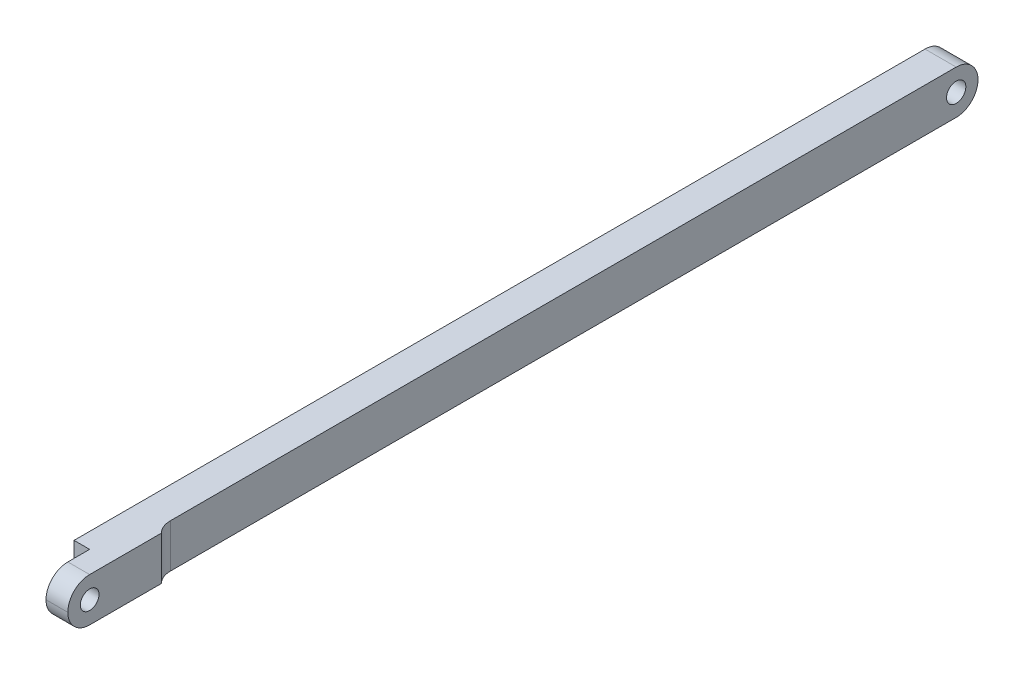
from build123d import *

# Parameters (mm, degrees)
SKETCH_1_W          = 5
SKETCH_1_H          = 7
EXTRUDE_2_DEPTH     = 140
FILLET_1_R          = 3.5
SKETCH_3_R          = 1.55
CUT_EXTRUDE_1_DEPTH = 141.132972565
SKETCH_4_W          = 2.5
SKETCH_4_H          = 7
EXTRUDE_3_DEPTH     = 7
SKETCH_5_W          = 15
SKETCH_5_H          = 7
EXTRUDE_4_DEPTH     = 1
FILLET_2_R          = 3.5
SKETCH_6_R          = 1.5
CUT_EXTRUDE_2_DEPTH = 148.083309726
FILLET_3_R          = 3.5


# Some blends are built 0.0001 mm under size
with BuildPart() as part:
    # 草图1 → 凸台-拉伸2 (new body)
    with BuildSketch(Plane.XY):
        Rectangle(SKETCH_1_W, SKETCH_1_H)
    extrude(amount=EXTRUDE_2_DEPTH)

    # 圆角1
    fillet_1_edges = [part.edges().sort_by_distance(p)[0] for p in [
        (0, -3.5, 0),
        (0, 3.5, 0),
    ]]
    fillet(fillet_1_edges, radius=FILLET_1_R - 0.0001)  # a hair under: the kernel refuses the full size

    # 草图3 → 切除-拉伸1 (cut, through all)
    with BuildSketch(Plane(origin=(2.5, 0, 0), x_dir=(0, 0, -1), z_dir=(1, 0, 0))):
        with Locations(Location((-3.5, 0, 0), (0, 0, 90))):
            Circle(SKETCH_3_R)
    extrude(amount=-CUT_EXTRUDE_1_DEPTH, mode=Mode.SUBTRACT)

    # 草图4 → 凸台-拉伸3 (add)
    with BuildSketch(Plane.XY.offset(140)):
        with Locations((1.25, 0)):
            Rectangle(SKETCH_4_W, SKETCH_4_H)
    extrude(amount=EXTRUDE_3_DEPTH)

    # 草图5 → 凸台-拉伸4 (add)
    with BuildSketch(Plane(origin=(2.5, 0, 0), x_dir=(0, 0, -1), z_dir=(1, 0, 0))):
        with Locations((-139.5, 0)):
            Rectangle(SKETCH_5_W, SKETCH_5_H)
    extrude(amount=EXTRUDE_4_DEPTH)

    # 圆角2
    fillet_2_edges = [part.edges().sort_by_distance(p)[0] for p in [
        (1.75, -3.5, 147),
        (1.75, 3.5, 147),
    ]]
    fillet(fillet_2_edges, radius=FILLET_2_R - 0.0001)  # a hair under: the kernel refuses the full size

    # 草图6 → 切除-拉伸2 (cut, through all)
    with BuildSketch(Plane.ZY):
        with Locations(Location((143.5, 0, 0), (0, 0, 270))):
            Circle(SKETCH_6_R)
    extrude(amount=-CUT_EXTRUDE_2_DEPTH, mode=Mode.SUBTRACT)

    # 圆角3
    # the kernel refuses this fillet: 3.5 mm, written as the material it adds along each edge
    with BuildSketch(Plane(origin=(2.5, 3.5, 132), x_dir=(1, 0, 0), z_dir=(0, -1, 0))) as fillet_3_piece_1:
        with BuildLine():
            CenterArc((3.5, -2.449489743), FILLET_3_R, 135.584691403, 44.415308597)
            Line((0, -2.449489743), (-0.07, -2.449489743))
            Line((-0.07, -2.449489743), (-0.07, 0))
            Line((-0.07, 0), (0, 0.07))
            ThreePointArc((0, 0.07), (0.5, 0.07), (0.95, 0.048989795))
            Line((0.95, 0.048989795), (1, 0))
        make_face()
    extrude(amount=7)


solid = part.part
